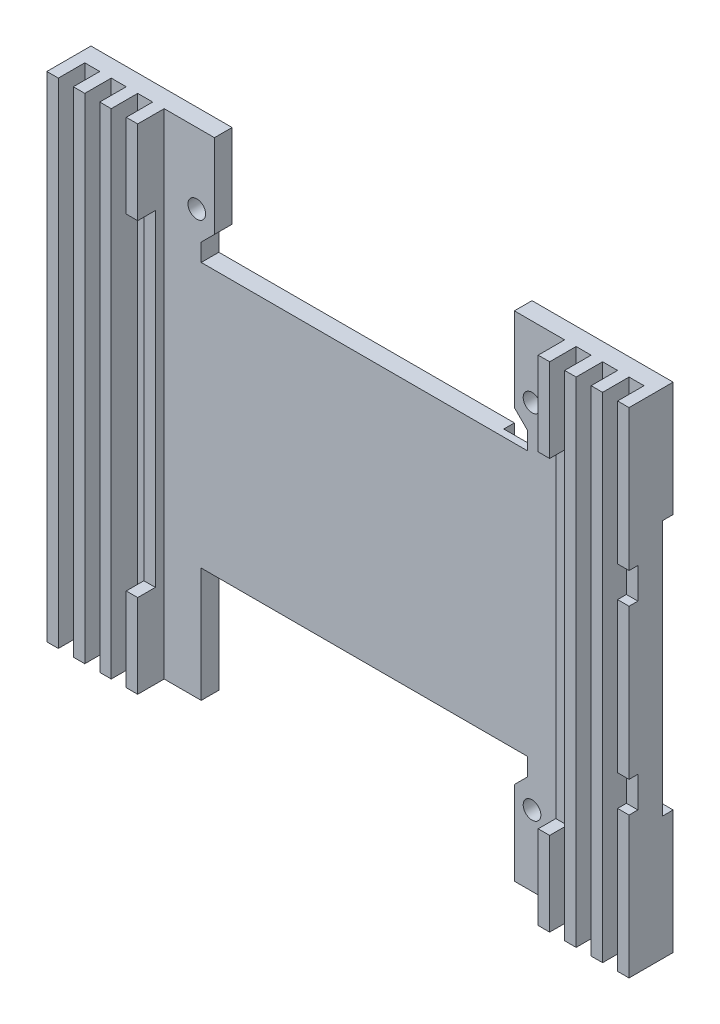
from build123d import *

# Parameters (mm, degrees)
SKETCH_1_R          = 1
EXTRUDE_1_DEPTH     = 2
SKETCH_2_W          = 1.3
SKETCH_2_H          = 56
EXTRUDE_2_DEPTH     = 3
SKETCH_3_W          = 20
SKETCH_3_H          = 14
CUT_EXTRUDE_1_DEPTH = 1.2
SKETCH_6_W          = 4.5
SKETCH_6_H          = 8
CUT_EXTRUDE_4_DEPTH = 1.2
SKETCH_4_W          = 1.3
SKETCH_4_H          = 3.5
CUT_EXTRUDE_2_DEPTH = 1
SKETCH_5_W          = 48
SKETCH_5_H          = 37
CUT_EXTRUDE_3_DEPTH = 2


with BuildPart() as part:
    # 草图1 → 凸台-拉伸1 (new body)
    with BuildSketch(Plane.XY):
        Polygon((18.5, 15), (-18.5, 15), (-18.5, 17), (-17, 18.5), (-17, 28), (-33, 28), (-33, -28), (-18.5, -28), (-18.5, -17), (-18.5, -15), (18.5, -15), (18.5, -17), (17, -18.5), (17, -28), (33, -28), (33, 28), (17, 28), (17, 18.5), (18.5, 17), align=None)
        with Locations((19, -20)):
            Circle(SKETCH_1_R, mode=Mode.SUBTRACT)
        with Locations((-19, 20)):
            Circle(SKETCH_1_R, mode=Mode.SUBTRACT)
        with Locations((19, 20)):
            Circle(SKETCH_1_R, mode=Mode.SUBTRACT)
    extrude(amount=EXTRUDE_1_DEPTH)

    # 草图2 → 凸台-拉伸2 (add)
    with BuildSketch(Plane.XY.offset(2)):
        with Locations((-32.35, 0)):
            Rectangle(SKETCH_2_W, SKETCH_2_H)
        with Locations((32.35, 0)):
            Rectangle(SKETCH_2_W, SKETCH_2_H)
        with Locations((-29.35, 0)):
            Rectangle(SKETCH_2_W, SKETCH_2_H)
        with Locations((-26.35, 0)):
            Rectangle(SKETCH_2_W, SKETCH_2_H)
        with Locations((-23.35, 0)):
            Rectangle(SKETCH_2_W, SKETCH_2_H)
        with Locations((29.35, 0)):
            Rectangle(SKETCH_2_W, SKETCH_2_H)
        with Locations((26.35, 0)):
            Rectangle(SKETCH_2_W, SKETCH_2_H)
        with Locations((23.35, 0)):
            Rectangle(SKETCH_2_W, SKETCH_2_H)
    extrude(amount=EXTRUDE_2_DEPTH)

    # 草图3 → 切除-拉伸1 (cut)
    with BuildSketch(Plane(origin=(0, 0, 0), x_dir=(-1, 0, 0), z_dir=(0, 0, -1))):
        with Locations((0, 4)):
            Rectangle(SKETCH_3_W, SKETCH_3_H)
        Polygon((-15, -3), (-15, 15), (-33, 15), (-33, -14), (-23, -14), (-23, -3), align=None)
    extrude(amount=-CUT_EXTRUDE_1_DEPTH, mode=Mode.SUBTRACT)

    # 草图6 → 切除-拉伸4 (cut)
    with BuildSketch(Plane(origin=(0, 0, 0), x_dir=(-1, 0, 0), z_dir=(0, 0, -1))):
        with Locations((27.25, -24)):
            Rectangle(SKETCH_6_W, SKETCH_6_H)
    extrude(amount=-CUT_EXTRUDE_4_DEPTH, mode=Mode.SUBTRACT)

    # 草图4 → 切除-拉伸2 (cut)
    with BuildSketch(Plane.XY.offset(5)):
        with Locations((32.35, -10.25)):
            Rectangle(SKETCH_4_W, SKETCH_4_H)
        with Locations((32.35, 10.25)):
            Rectangle(SKETCH_4_W, SKETCH_4_H)
    extrude(amount=-CUT_EXTRUDE_2_DEPTH, mode=Mode.SUBTRACT)

    # 草图5 → 切除-拉伸3 (cut)
    with BuildSketch(Plane.XY.offset(5)):
        Rectangle(SKETCH_5_W, SKETCH_5_H)
    extrude(amount=-CUT_EXTRUDE_3_DEPTH, mode=Mode.SUBTRACT)


solid = part.part
